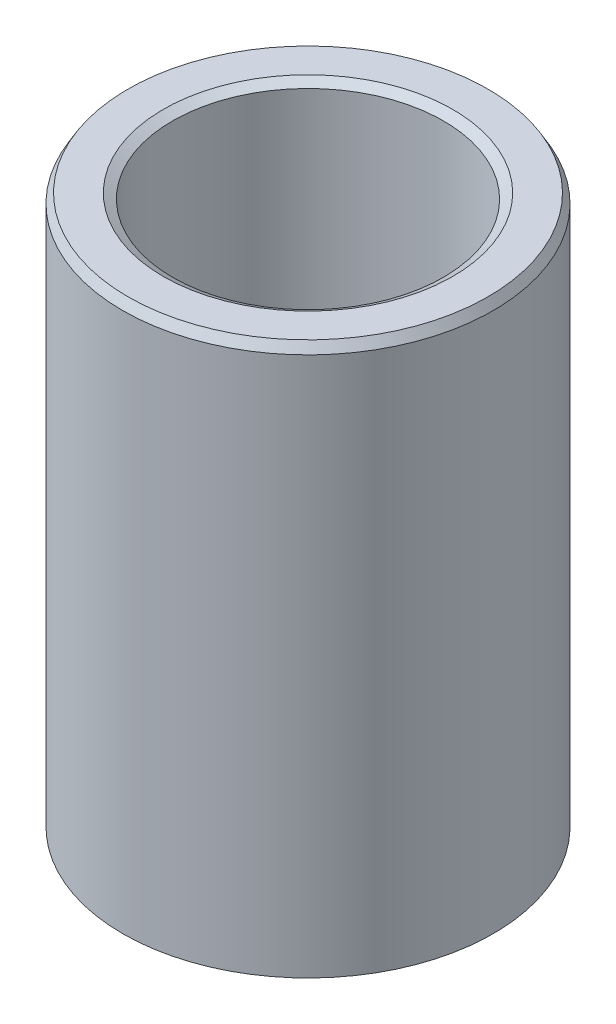
from build123d import *
from OCP.BRepFilletAPI import BRepFilletAPI_MakeChamfer

# Parameters (mm, degrees)
SKETCH1_R           = 35
BOSS_EXTRUDE1_DEPTH = 104.685781089
SKETCH2_R           = 25.592710877
CUT_EXTRUDE1_DEPTH  = 116.797723476
CHAMFER1_SIZE       = 1.74711285
CHAMFER1_SIZE2      = 1.008696074


with BuildPart() as part:
    # Sketch1 → Boss-Extrude1 (new body)
    with BuildSketch(Plane(origin=(0, 0, 0), x_dir=(1, 0, 0), z_dir=(0, 1, 0))):
        Circle(SKETCH1_R)
    extrude(amount=BOSS_EXTRUDE1_DEPTH)

    # Sketch2 → Cut-Extrude1 (cut, through all)
    with BuildSketch(Plane(origin=(0, 0, 0), x_dir=(1, 0, 0), z_dir=(0, 1, 0))):
        Circle(SKETCH2_R)
    extrude(amount=CUT_EXTRUDE1_DEPTH, mode=Mode.SUBTRACT)

    # Chamfer1: one chamfer whose edges measure the first distance from different faces: ONE call of the kernel's chamfer builder (chamfer() names one face for all edges)
    chamfer1_edges_1 = [part.edges().sort_by_distance(p)[0] for p in [
        (-25.592710877, 104.685781089, 0),
    ]]
    chamfer1_side_1 = [part.faces().sort_by_distance(p)[0] for p in [
        (-34.010050506, 104.685781089, 0),
    ]]
    chamfer1_edges_2 = [part.edges().sort_by_distance(p)[0] for p in [
        (-25.592710877, 0, 0),
    ]]
    chamfer1_side_2 = [part.faces().sort_by_distance(p)[0] for p in [
        (-25.592710877, 52.342890544, 0),
    ]]
    chamfer1_edges_3 = [part.edges().sort_by_distance(p)[0] for p in [
        (-35, 0, 0),
    ]]
    chamfer1_side_3 = [part.faces().sort_by_distance(p)[0] for p in [
        (-34.010050506, 0, 0),
    ]]
    chamfer1_edges_4 = [part.edges().sort_by_distance(p)[0] for p in [
        (-35, 104.685781089, 0),
    ]]
    chamfer1_side_4 = [part.faces().sort_by_distance(p)[0] for p in [
        (-35, 52.342890544, 0),
    ]]
    chamfer1 = BRepFilletAPI_MakeChamfer(part.part.solid().wrapped)
    for e in chamfer1_edges_1:
        chamfer1.Add(CHAMFER1_SIZE, CHAMFER1_SIZE2, e.wrapped, chamfer1_side_1[0].wrapped)  # the first distance lies on this face
    for e in chamfer1_edges_2:
        chamfer1.Add(CHAMFER1_SIZE, CHAMFER1_SIZE2, e.wrapped, chamfer1_side_2[0].wrapped)  # the first distance lies on this face
    for e in chamfer1_edges_3:
        chamfer1.Add(CHAMFER1_SIZE, CHAMFER1_SIZE2, e.wrapped, chamfer1_side_3[0].wrapped)  # the first distance lies on this face
    for e in chamfer1_edges_4:
        chamfer1.Add(CHAMFER1_SIZE, CHAMFER1_SIZE2, e.wrapped, chamfer1_side_4[0].wrapped)  # the first distance lies on this face
    add(Compound.cast(chamfer1.Shape()), mode=Mode.REPLACE)


solid = part.part
